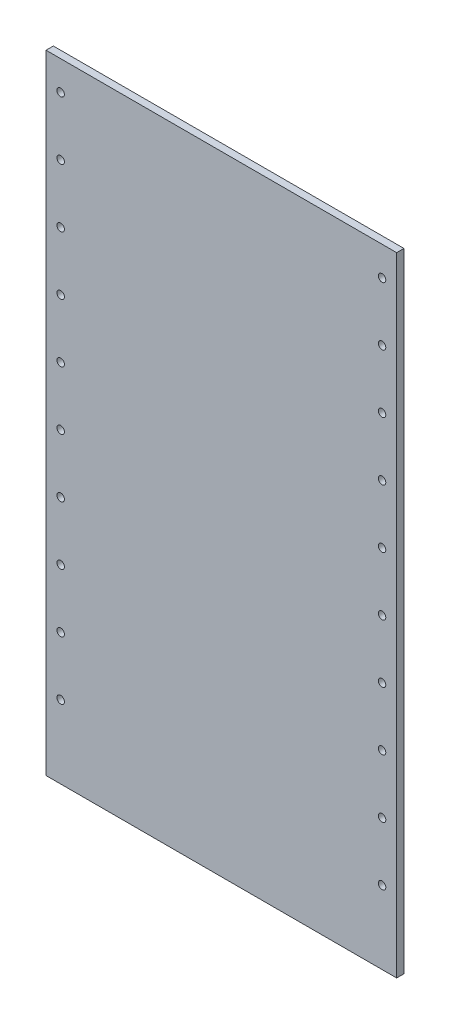
from build123d import *

# Parameters (mm, degrees)
SKETCH1_W           = 152.4
SKETCH1_H           = 273.05
SKETCH1_R           = 1.63195
BOSS_EXTRUDE1_DEPTH = 3.175


with BuildPart() as part:
    # Sketch1 → Boss-Extrude1 (new body)
    with BuildSketch(Plane.XY):
        with Locations((76.2, -136.525)):
            Rectangle(SKETCH1_W, SKETCH1_H)
        with Locations((6.35, -12.7)):
            Circle(SKETCH1_R, mode=Mode.SUBTRACT)
        with Locations((146.05, -12.7)):
            Circle(SKETCH1_R, mode=Mode.SUBTRACT)
        with Locations((146.05, -38.1)):
            Circle(SKETCH1_R, mode=Mode.SUBTRACT)
        with Locations((146.05, -63.5)):
            Circle(SKETCH1_R, mode=Mode.SUBTRACT)
        with Locations((146.05, -88.9)):
            Circle(SKETCH1_R, mode=Mode.SUBTRACT)
        with Locations((146.05, -114.3)):
            Circle(SKETCH1_R, mode=Mode.SUBTRACT)
        with Locations((146.05, -139.7)):
            Circle(SKETCH1_R, mode=Mode.SUBTRACT)
        with Locations((146.05, -165.1)):
            Circle(SKETCH1_R, mode=Mode.SUBTRACT)
        with Locations((146.05, -190.5)):
            Circle(SKETCH1_R, mode=Mode.SUBTRACT)
        with Locations((146.05, -215.9)):
            Circle(SKETCH1_R, mode=Mode.SUBTRACT)
        with Locations((146.05, -241.3)):
            Circle(SKETCH1_R, mode=Mode.SUBTRACT)
        with Locations((6.35, -38.1)):
            Circle(SKETCH1_R, mode=Mode.SUBTRACT)
        with Locations((6.35, -63.5)):
            Circle(SKETCH1_R, mode=Mode.SUBTRACT)
        with Locations((6.35, -88.9)):
            Circle(SKETCH1_R, mode=Mode.SUBTRACT)
        with Locations((6.35, -114.3)):
            Circle(SKETCH1_R, mode=Mode.SUBTRACT)
        with Locations((6.35, -139.7)):
            Circle(SKETCH1_R, mode=Mode.SUBTRACT)
        with Locations((6.35, -165.1)):
            Circle(SKETCH1_R, mode=Mode.SUBTRACT)
        with Locations((6.35, -190.5)):
            Circle(SKETCH1_R, mode=Mode.SUBTRACT)
        with Locations((6.35, -215.9)):
            Circle(SKETCH1_R, mode=Mode.SUBTRACT)
        with Locations((6.35, -241.3)):
            Circle(SKETCH1_R, mode=Mode.SUBTRACT)
    extrude(amount=BOSS_EXTRUDE1_DEPTH)


solid = part.part
